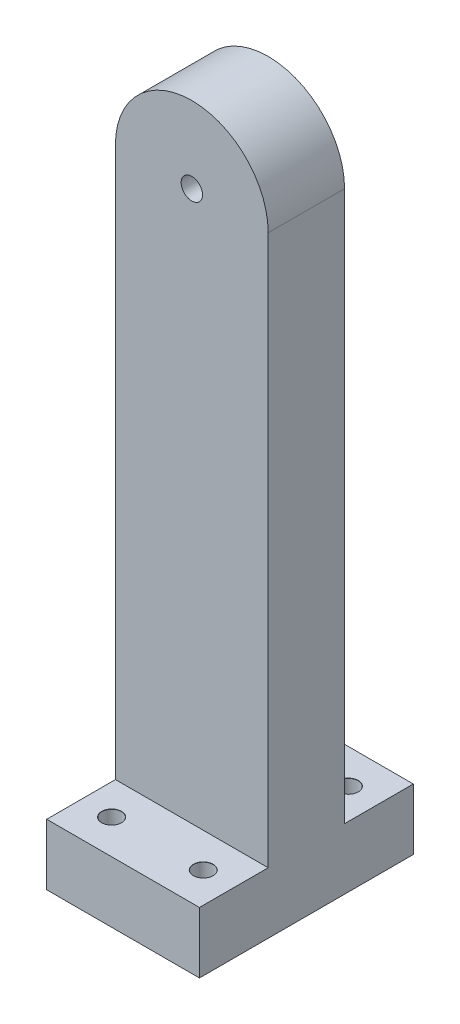
from build123d import *

# Parameters (mm, degrees)
SKETCH1_R                            = 1.75
BOSS_EXTRUDE1_DEPTH                  = 35
SKETCH5_W                            = 11.25
SKETCH5_H                            = 102.5
CUT_EXTRUDE1_DEPTH                   = 121.441894704
F_3_2_3_2_DIAMETER_HOLE1_D           = 3.2
F_3_2_3_2_DIAMETER_HOLE1_CSINK_D     = 3.25
F_3_2_3_2_DIAMETER_HOLE1_CSINK_ANGLE = 90


with BuildPart() as part:
    # Sketch1 → Boss-Extrude1 (new body)
    with BuildSketch(Plane.XY):
        with BuildLine():
            Line((0, 0), (-12.5, 0))
            Line((-12.5, 0), (-12.5, 100))
            ThreePointArc((-12.5, 100), (0, 112.5), (12.5, 100))
            Line((12.5, 100), (12.5, 0))
            Line((12.5, 0), (0, 0))
        make_face()
        with Locations((0, 100)):
            Circle(SKETCH1_R, mode=Mode.SUBTRACT)
    extrude(amount=BOSS_EXTRUDE1_DEPTH)

    # Sketch5 → Cut-Extrude1 (cut, through all)
    with BuildSketch(Plane(origin=(12.5, 0, 0), x_dir=(0, 0, -1), z_dir=(1, 0, 0))):
        with Locations((-29.375, 61.25)):
            Rectangle(SKETCH5_W, SKETCH5_H)
        with Locations((-5.625, 61.25)):
            Rectangle(SKETCH5_W, SKETCH5_H)
    extrude(amount=-CUT_EXTRUDE1_DEPTH, mode=Mode.SUBTRACT)

    # Ø3.2 (3.2) Diameter Hole1 (through all)
    with Locations(Plane(origin=(0, 10, 0), x_dir=(1, 0, 0), z_dir=(0, 1, 0))):
        with Locations((-7.5, -5.625), (7.5, -5.625), (7.5, -29.375), (-7.5, -29.375)):
            CounterSinkHole(F_3_2_3_2_DIAMETER_HOLE1_D / 2, F_3_2_3_2_DIAMETER_HOLE1_CSINK_D / 2, counter_sink_angle=F_3_2_3_2_DIAMETER_HOLE1_CSINK_ANGLE)


solid = part.part
